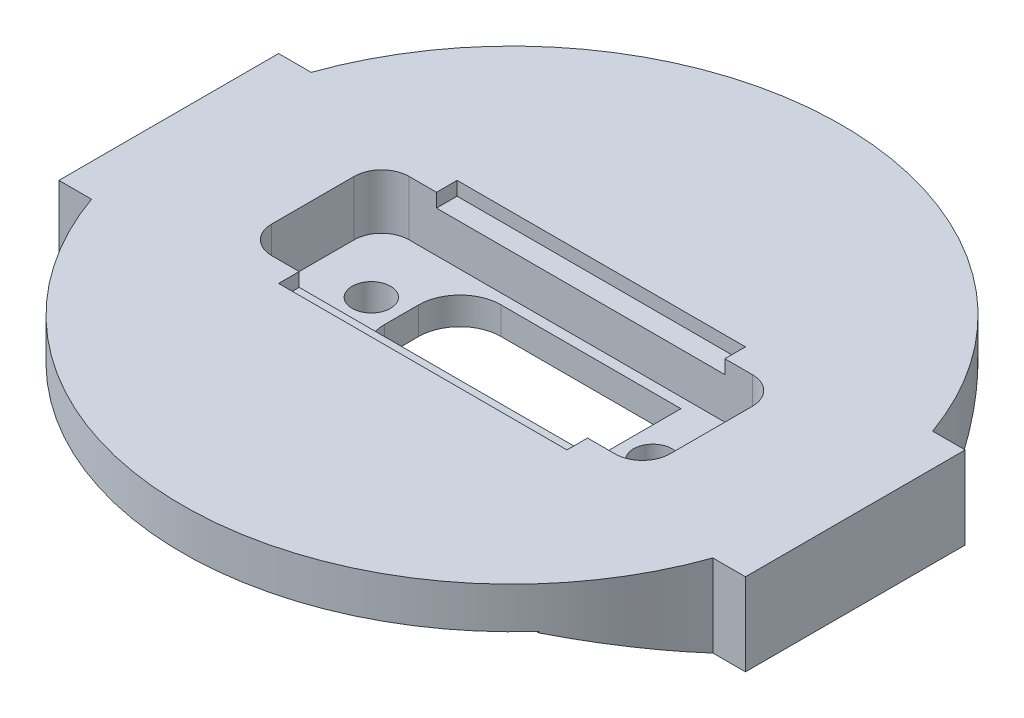
from build123d import *

# Parameters (mm, degrees)
BOSS_EXTRUDE1_DEPTH = 6
CUT_EXTRUDE1_DEPTH  = 10
CUT_EXTRUDE2_DEPTH  = 4
SKETCH4_W           = 21
SKETCH4_H           = 13
CUT_EXTRUDE3_DEPTH  = 1
SKETCH5_R           = 1.4
CUT_EXTRUDE4_DEPTH  = 10
CUT_EXTRUDE8_START  = -22.627416998
CUT_EXTRUDE8_DEPTH  = 45.254833996
SKETCH8_W           = 50.670468249
SKETCH8_H           = 10.499687698
SKETCH8_W_2         = 48.947034964
SKETCH8_H_2         = 10.380689976
CUT_EXTRUDE9_DEPTH  = 3


# Read off the part's stored shape, not the designer's step: Cut-Extrude8
with BuildPart() as part:
    # Sketch1 → Boss-Extrude1 (new body)
    with BuildSketch(Plane(origin=(0, 0, 0), x_dir=(1, 0, 0), z_dir=(0, 1, 0))):
        with BuildLine():
            Line((22.627416998, 8), (25, 8))
            Line((25, 8), (25, -8))
            Line((25, -8), (22.627416998, -8))
            ThreePointArc((22.627416998, -8), (0, -24), (-22.627416998, -8))
            Line((-22.627416998, -8), (-25, -8))
            Line((-25, -8), (-25, 8))
            Line((-25, 8), (-22.627416998, 8))
            ThreePointArc((-22.627416998, 8), (0, 24), (22.627416998, 8))
        make_face()
    extrude(amount=BOSS_EXTRUDE1_DEPTH)

    # Sketch2 → Cut-Extrude1 (cut)
    with BuildSketch(Plane(origin=(0, 6, 0), x_dir=(1, 0, 0), z_dir=(0, 1, 0))):
        with BuildLine():
            Line((-5.05, -4.25), (8.05, -4.25))
            Line((8.05, -4.25), (8.05, 4.25))
            Line((8.05, 4.25), (-5.05, 4.25))
            ThreePointArc((-5.05, 4.25), (-7.171320344, 3.371320344), (-8.05, 1.25))
            Line((-8.05, 1.25), (-8.05, -1.25))
            ThreePointArc((-8.05, -1.25), (-7.171320344, -3.371320344), (-5.05, -4.25))
        make_face()
    extrude(amount=-CUT_EXTRUDE1_DEPTH, mode=Mode.SUBTRACT)

    # Sketch3 → Cut-Extrude2 (cut)
    with BuildSketch(Plane(origin=(0, 6, 0), x_dir=(1, 0, 0), z_dir=(0, 1, 0))):
        with BuildLine():
            Line((-12.5, -5), (12.5, -5))
            ThreePointArc((12.5, -5), (13.914213562, -4.414213562), (14.5, -3))
            Line((14.5, -3), (14.5, 3))
            ThreePointArc((14.5, 3), (13.914213562, 4.414213562), (12.5, 5))
            Line((12.5, 5), (-12.5, 5))
            ThreePointArc((-12.5, 5), (-13.914213562, 4.414213562), (-14.5, 3))
            Line((-14.5, 3), (-14.5, -3))
            ThreePointArc((-14.5, -3), (-13.914213562, -4.414213562), (-12.5, -5))
        make_face()
    extrude(amount=-CUT_EXTRUDE2_DEPTH, mode=Mode.SUBTRACT)

    # Sketch4 → Cut-Extrude3 (cut)
    with BuildSketch(Plane(origin=(0, 6, 0), x_dir=(1, 0, 0), z_dir=(0, 1, 0))):
        Rectangle(SKETCH4_W, SKETCH4_H)
    extrude(amount=-CUT_EXTRUDE3_DEPTH, mode=Mode.SUBTRACT)

    # Sketch5 → Cut-Extrude4 (cut)
    with BuildSketch(Plane(origin=(0, 2, 0), x_dir=(1, 0, 0), z_dir=(0, 1, 0))):
        with Locations(Location((-10.25, 0, 0), (0, 0, 270))):
            Circle(SKETCH5_R)
        with Locations(Location((10.25, 0, 0), (0, 0, 270))):
            Circle(SKETCH5_R)
    extrude(amount=-CUT_EXTRUDE4_DEPTH, mode=Mode.SUBTRACT)

    # Cut-Extrude8 outline → Cut-Extrude8 (cut)
    with BuildSketch(Plane.YZ.offset(CUT_EXTRUDE8_START)):
        Polygon((0, -24.445099732), (0.162003054, -24), (2.992763401, -16.222549867), (0, -8), align=None)
        Polygon((0, 23.933160472), (0, 8), (2.899598075, 15.966580236), align=None)
    extrude(amount=CUT_EXTRUDE8_DEPTH, mode=Mode.SUBTRACT)

    # Sketch8 → Cut-Extrude9 (cut)
    with BuildSketch(Plane.XZ):
        with Locations((1.133817479, 21.216424085)):
            Rectangle(SKETCH8_W, SKETCH8_H)
        with Locations((0.272100837, -21.412894855)):
            Rectangle(SKETCH8_W_2, SKETCH8_H_2)
    extrude(amount=-CUT_EXTRUDE9_DEPTH, mode=Mode.SUBTRACT)


solid = part.part
